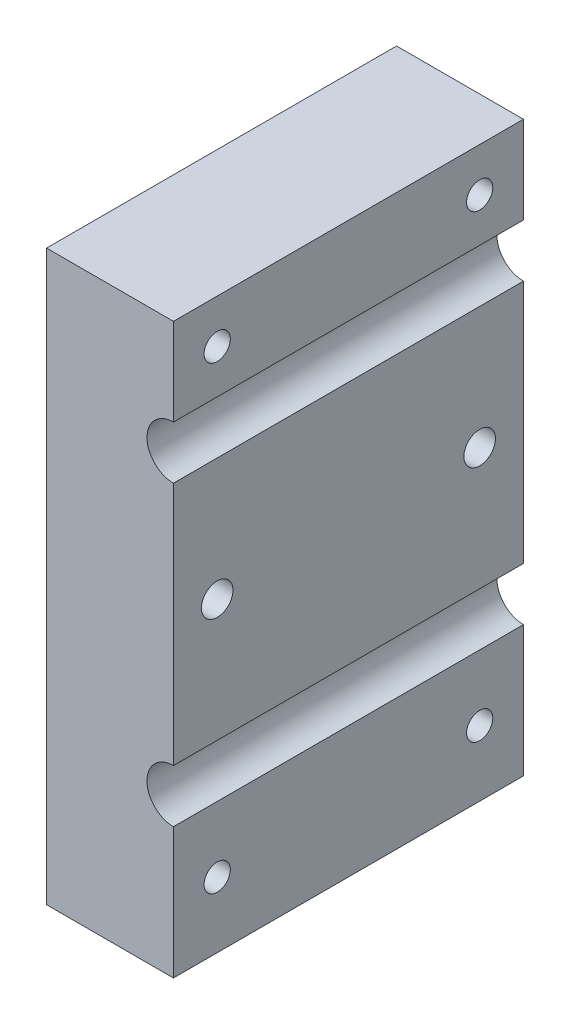
from build123d import *

# Parameters (mm, degrees)
SKETCH_1_W          = 29
SKETCH_1_H          = 65
EXTRUDE_1_DEPTH     = 40
SKETCH_2_R          = 3.025
SKETCH_2_R_2        = 3.005
CUT_EXTRUDE_3_DEPTH = 82.645575508
SKETCH_6_W          = 14.5
SKETCH_6_H          = 65
CUT_EXTRUDE_4_DEPTH = 82.645575508
SKETCH_7_R          = 1.5
CUT_EXTRUDE_5_DEPTH = 78.686871478
SKETCH_8_R          = 1.804783807
CUT_EXTRUDE_6_DEPTH = 78.686871478
SKETCH_9_R          = 1.5
CUT_EXTRUDE_7_DEPTH = 78.686871478


with BuildPart() as part:
    # 草图1 → 凸台-拉伸1 (new body)
    with BuildSketch(Plane.XY):
        with Locations((14.5, 32.5)):
            Rectangle(SKETCH_1_W, SKETCH_1_H)
    extrude(amount=EXTRUDE_1_DEPTH)

    # 草图2 → 切除-拉伸3 (cut, through all)
    # profile 1 of 2: a face of its own
    with BuildSketch(Plane.XY.offset(40)):
        with Locations((14.5, 52)):
            Circle(SKETCH_2_R)
        with Locations((14.5, 52)):
            Circle(SKETCH_2_R_2, mode=Mode.SUBTRACT)
    # profile 2 of 2: a face of its own
    with BuildSketch(Plane.XY.offset(40)):
        with Locations((14.5, 18)):
            Circle(SKETCH_2_R)
        with Locations((14.5, 18)):
            Circle(SKETCH_2_R_2, mode=Mode.SUBTRACT)
    extrude(amount=-CUT_EXTRUDE_3_DEPTH, mode=Mode.SUBTRACT)


with BuildPart() as body_2:
    # of the pieces the cut leaves, the one that is kept (cut_extrude_3_keep)
    add(part.part.solids().sort_by_distance((0, 0, 0))[0])

    # 草图6 → 切除-拉伸4 (cut, through all)
    with BuildSketch(Plane.XY.offset(40)):
        with Locations((21.75, 32.5)):
            Rectangle(SKETCH_6_W, SKETCH_6_H)
    extrude(amount=-CUT_EXTRUDE_4_DEPTH, mode=Mode.SUBTRACT)

    # 草图7 → 切除-拉伸5 (cut, through all)
    with BuildSketch(Plane(origin=(14.5, 0, 0), x_dir=(0, 0, -1), z_dir=(1, 0, 0))):
        with Locations((-35, 60.0125)):
            Circle(SKETCH_7_R)
        with Locations((-5, 60.0125)):
            Circle(SKETCH_7_R)
    extrude(amount=-CUT_EXTRUDE_5_DEPTH, mode=Mode.SUBTRACT)

    # 草图8 → 切除-拉伸6 (cut, through all)
    with BuildSketch(Plane(origin=(14.5, 0, 0), x_dir=(0, 0, -1), z_dir=(1, 0, 0))):
        with Locations((-35, 35)):
            Circle(SKETCH_8_R)
        with Locations((-5, 35)):
            Circle(SKETCH_8_R)
    extrude(amount=-CUT_EXTRUDE_6_DEPTH, mode=Mode.SUBTRACT)

    # 草图9 → 切除-拉伸7 (cut, through all)
    with BuildSketch(Plane(origin=(14.5, 0, 0), x_dir=(0, 0, -1), z_dir=(1, 0, 0))):
        with Locations((-35, 7.4875)):
            Circle(SKETCH_9_R)
        with Locations((-5, 7.4875)):
            Circle(SKETCH_9_R)
    extrude(amount=-CUT_EXTRUDE_7_DEPTH, mode=Mode.SUBTRACT)


solid = body_2.part
